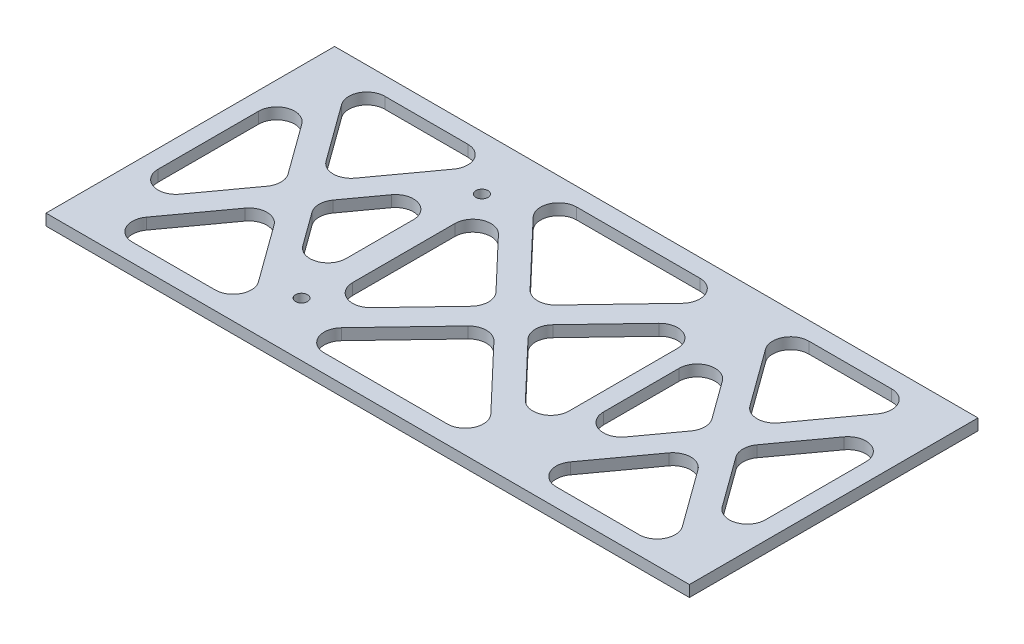
from build123d import *

# Parameters (mm, degrees)
SKETCH1_W           = 271.78
SKETCH1_H           = 121.92
SKETCH1_R           = 2.54
BOSS_EXTRUDE1_DEPTH = 4.7625
FILLET1_R           = 7.62


with BuildPart() as part:
    # Sketch1 → Boss-Extrude1 (new body)
    with BuildSketch(Plane(origin=(0, 0, 0), x_dir=(1, 0, 0), z_dir=(0, 1, 0))):
        Rectangle(SKETCH1_W, SKETCH1_H)
        Polygon((121.991825716, -53.34), (57.078174284, -53.34), (89.535, -8.645354751), align=None, mode=Mode.SUBTRACT)
        Polygon((128.27, 44.694645249), (128.27, -44.694645249), (95.813174284, 0), align=None, mode=Mode.SUBTRACT)
        Polygon((57.078174284, 53.34), (121.991825716, 53.34), (89.535, 8.645354751), align=None, mode=Mode.SUBTRACT)
        Polygon((83.256825716, 0), (54.61, -39.448087872), (54.61, 39.448087872), align=None, mode=Mode.SUBTRACT)
        Polygon((43.784761905, -53.34), (-43.784761905, -53.34), (0, -7.366), align=None, mode=Mode.SUBTRACT)
        Polygon((46.99, -41.9735), (7.015238095, 0), (46.99, 41.9735), align=None, mode=Mode.SUBTRACT)
        Polygon((-43.784761905, 53.34), (43.784761905, 53.34), (0, 7.366), align=None, mode=Mode.SUBTRACT)
        Polygon((-7.015238095, 0), (-45.72, -40.64), (-45.72, 40.64), align=None, mode=Mode.SUBTRACT)
        Polygon((-121.991825716, 53.34), (-57.078174284, 53.34), (-89.535, 8.645354751), align=None, mode=Mode.SUBTRACT)
        Polygon((-128.27, -44.694645249), (-128.27, 44.694645249), (-95.813174284, 0), align=None, mode=Mode.SUBTRACT)
        Polygon((-57.078174284, -53.34), (-121.991825716, -53.34), (-89.535, -8.645354751), align=None, mode=Mode.SUBTRACT)
        Polygon((-55.88, -37.699235413), (-83.256825716, 0), (-55.88, 37.699235413), align=None, mode=Mode.SUBTRACT)
        with Locations((-50.8, -38.1)):
            Circle(SKETCH1_R, mode=Mode.SUBTRACT)
        with Locations((-50.8, 38.1)):
            Circle(SKETCH1_R, mode=Mode.SUBTRACT)
    extrude(amount=BOSS_EXTRUDE1_DEPTH)

    # Fillet1
    fillet1_edges = [part.edges().sort_by_distance(p)[0] for p in [
        (54.61, 2.38125, 39.448087872),
        (89.535, 2.38125, -8.645354751),
        (0, 2.38125, -7.366),
        (-55.88, 2.38125, -37.699235413),
        (-121.991825716, 2.38125, -53.34),
        (-43.784761905, 2.38125, -53.34),
        (-45.72, 2.38125, 40.64),
        (-55.88, 2.38125, 37.699235413),
        (-89.535, 2.38125, -8.645354751),
        (-89.535, 2.38125, 8.645354751),
        (0, 2.38125, 7.366),
        (89.535, 2.38125, 8.645354751),
        (128.27, 2.38125, -44.694645249),
        (57.078174284, 2.38125, -53.34),
        (54.61, 2.38125, -39.448087872),
        (46.99, 2.38125, -41.9735),
        (-45.72, 2.38125, -40.64),
        (46.99, 2.38125, 41.9735),
        (-83.256825716, 2.38125, 0),
        (95.813174284, 2.38125, 0),
        (7.015238095, 2.38125, 0),
        (-43.784761905, 2.38125, 53.34),
        (-121.991825716, 2.38125, 53.34),
        (57.078174284, 2.38125, 53.34),
        (128.27, 2.38125, 44.694645249),
        (121.991825716, 2.38125, 53.34),
        (-57.078174284, 2.38125, 53.34),
        (43.784761905, 2.38125, 53.34),
        (-7.015238095, 2.38125, 0),
        (83.256825716, 2.38125, 0),
        (121.991825716, 2.38125, -53.34),
        (43.784761905, 2.38125, -53.34),
        (-57.078174284, 2.38125, -53.34),
        (-95.813174284, 2.38125, 0),
        (-128.27, 2.38125, 44.694645249),
        (-128.27, 2.38125, -44.694645249),
    ]]
    fillet(fillet1_edges, radius=FILLET1_R)


solid = part.part
